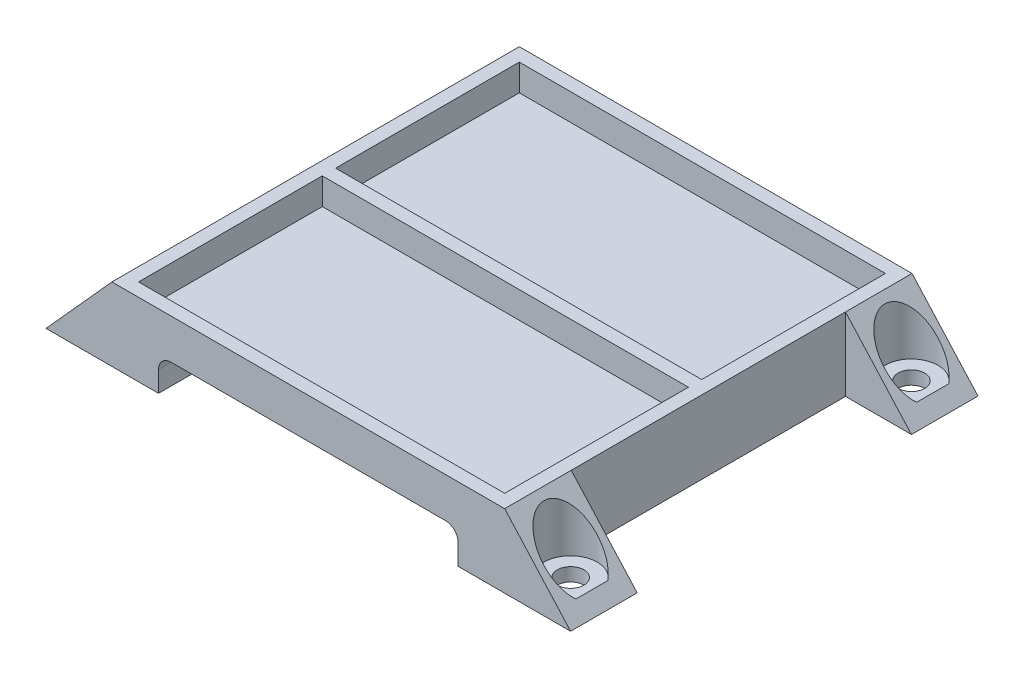
from build123d import *

# Parameters (mm, degrees)
SKETCH1_W           = 74.93
SKETCH1_H           = 40.132
SKETCH1_W_2         = 69.85
SKETCH1_H_2         = 35.052
BOSS_EXTRUDE1_DEPTH = 5.08
SKETCH2_W           = 74.93
SKETCH2_H           = 77.724
BOSS_EXTRUDE2_DEPTH = 2.54
SKETCH3_W           = 8.89
SKETCH3_H           = 77.724
BOSS_EXTRUDE3_DEPTH = 6.35
SKETCH5_W           = 12.7
SKETCH5_H           = 13.97
BOSS_EXTRUDE5_DEPTH = 12.7
SKETCH6_W           = 12.7
SKETCH6_H           = 13.97
BOSS_EXTRUDE6_DEPTH = 12.7
CHAMFER2_SIZE       = 12.7
CHAMFER2_SIZE_2     = 14.104778938
SKETCH7_R           = 2.54
CUT_EXTRUDE1_DEPTH  = 78.614252678
CUT_EXTRUDE2_START  = -2.54
SKETCH8_R           = 5.08
CUT_EXTRUDE2_DEPTH  = 76.074252678
FILLET1_R           = 2.38


with BuildPart() as part:
    # Sketch1 → Boss-Extrude1 (new body)
    # profile 1 of 2: a face of its own
    with BuildSketch(Plane(origin=(0, 0, 0), x_dir=(1, 0, 0), z_dir=(0, 1, 0))):
        Polygon((-37.465, 57.658), (-37.465, 20.066), (-34.925, 20.066), (-34.925, 55.118), (34.925, 55.118), (34.925, 20.066), (37.465, 20.066), (37.465, 57.658), align=None)
    # profile 2 of 2: a face of its own
    with BuildSketch(Plane(origin=(0, 0, 0), x_dir=(1, 0, 0), z_dir=(0, 1, 0))):
        Rectangle(SKETCH1_W, SKETCH1_H)
        Rectangle(SKETCH1_W_2, SKETCH1_H_2, mode=Mode.SUBTRACT)
    extrude(amount=BOSS_EXTRUDE1_DEPTH)

    # Sketch2 → Boss-Extrude2 (add)
    with BuildSketch(Plane.XZ):
        with Locations((0, -18.796)):
            Rectangle(SKETCH2_W, SKETCH2_H)
    extrude(amount=BOSS_EXTRUDE2_DEPTH)

    # Sketch3 → Boss-Extrude3 (add)
    with BuildSketch(Plane(origin=(0, -2.54, 0), x_dir=(-1, 0, 0), z_dir=(0, -1, 0))):
        with Locations((-33.02, 18.796)):
            Rectangle(SKETCH3_W, SKETCH3_H)
        with Locations((33.02, 18.796)):
            Rectangle(SKETCH3_W, SKETCH3_H)
    extrude(amount=BOSS_EXTRUDE3_DEPTH)

    # Sketch5 → Boss-Extrude5 (add)
    with BuildSketch(Plane(origin=(37.465, 0, 0), x_dir=(0, 0, -1), z_dir=(1, 0, 0))):
        with Locations((51.308, -1.905)):
            Rectangle(SKETCH5_W, SKETCH5_H)
        with Locations((-13.716, -1.905)):
            Rectangle(SKETCH5_W, SKETCH5_H)
    extrude(amount=BOSS_EXTRUDE5_DEPTH)

    # Sketch6 → Boss-Extrude6 (add)
    with BuildSketch(Plane.ZY.offset(37.465)):
        with Locations((-51.308, -1.905)):
            Rectangle(SKETCH6_W, SKETCH6_H)
        with Locations((13.716, -1.905)):
            Rectangle(SKETCH6_W, SKETCH6_H)
    extrude(amount=BOSS_EXTRUDE6_DEPTH)

    # Chamfer2
    # the kernel refuses this chamfer: 14.104778938, 12.7 mm, written as the material it takes off along each edge
    with BuildSketch(Plane(origin=(50.165, 5.08, -28.95640044), x_dir=(-0.9994864482690293, 0.03204434000819555, 0), z_dir=(0, 0, 1))) as chamfer2_piece_1:
        Polygon((CHAMFER2_SIZE * 0.999486448269, CHAMFER2_SIZE * 0.0320443400082), (-CHAMFER2_SIZE_2 * 0.0320443400089, CHAMFER2_SIZE_2 * 0.999486448292), (0, 0), align=None)
    extrude(amount=85.34480088, mode=Mode.SUBTRACT)
    with BuildSketch(Plane(origin=(50.165, 5.08, -8.63559956), x_dir=(-0.9994864482690293, 0.03204434000819555, 0), z_dir=(0, 0, -1)), Plane(origin=(-50.165, 5.08, -28.95640044), x_dir=(0.9994864482690293, 0.03204434000819555, 0), z_dir=(0, 0, 1)), Plane(origin=(-50.165, 5.08, -93.98040044), x_dir=(0.9994864482690293, 0.03204434000819555, 0), z_dir=(0, 0, 1))) as chamfer2_piece_2:
        Polygon((CHAMFER2_SIZE * 0.999486448269, -CHAMFER2_SIZE * 0.0320443400082), (-CHAMFER2_SIZE_2 * 0.0320443400089, -CHAMFER2_SIZE_2 * 0.999486448292), (0, 0), align=None)
    extrude(amount=85.34480088, mode=Mode.SUBTRACT)

    # Sketch7 → Cut-Extrude1 (cut, through all)
    with BuildSketch(Plane(origin=(0, -8.89, 0), x_dir=(-1, 0, 0), z_dir=(0, -1, 0))):
        with Locations(Location((-43.693644499, 51.308, 0), (0, 0, 90))):
            Circle(SKETCH7_R)
        with Locations(Location((-43.693644499, -13.716, 0), (0, 0, 90))):
            Circle(SKETCH7_R)
        with Locations(Location((43.693644499, -13.716, 0), (0, 0, 90))):
            Circle(SKETCH7_R)
        with Locations(Location((43.693644499, 51.308, 0), (0, 0, 90))):
            Circle(SKETCH7_R)
    extrude(amount=-CUT_EXTRUDE1_DEPTH, mode=Mode.SUBTRACT)

    # Sketch8 → Cut-Extrude2 (cut, through all)
    with BuildSketch(Plane(origin=(0, -8.89, 0), x_dir=(-1, 0, 0), z_dir=(0, -1, 0)).offset(CUT_EXTRUDE2_START)):
        with Locations((-43.693644499, 51.308)):
            Circle(SKETCH8_R)
        with Locations((-43.693644499, -13.716)):
            Circle(SKETCH8_R)
        with Locations((43.693644499, -13.716)):
            Circle(SKETCH8_R)
        with Locations((43.693644499, 51.308)):
            Circle(SKETCH8_R)
    extrude(amount=-CUT_EXTRUDE2_DEPTH, mode=Mode.SUBTRACT)

    # Fillet1
    fillet1_edges = [part.edges().sort_by_distance(p)[0] for p in [
        (28.575, -2.54, -18.796),
        (-28.575, -2.54, -18.796),
    ]]
    fillet(fillet1_edges, radius=FILLET1_R)


solid = part.part
